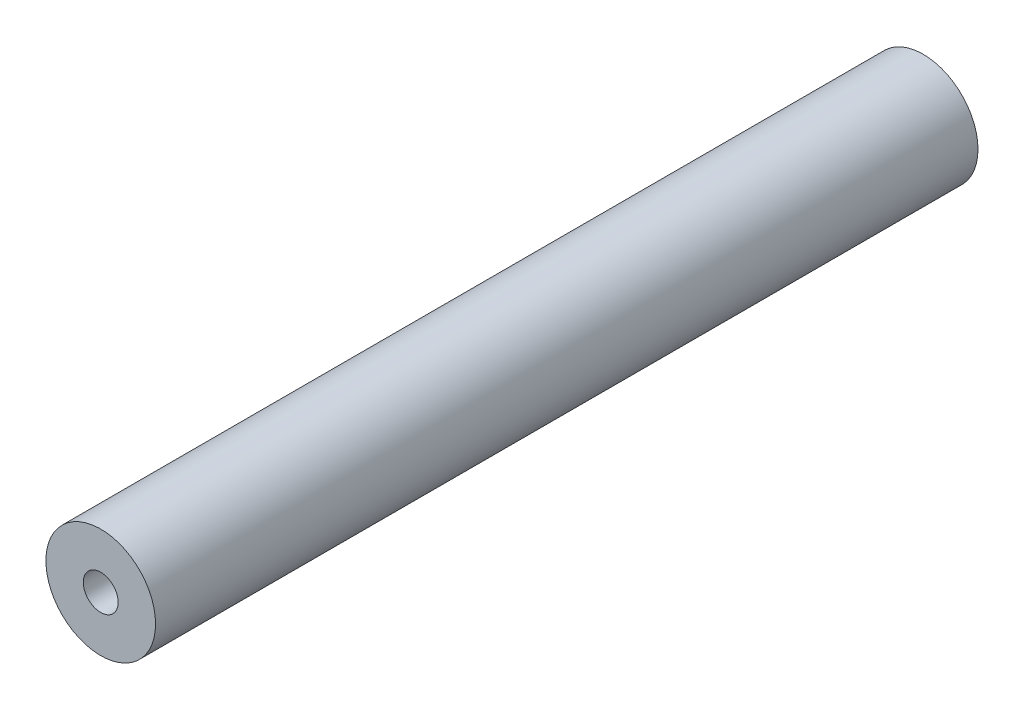
from build123d import *

# Parameters (mm, degrees)
SKETCH1_R                            = 6.35
BOSS_EXTRUDE1_DEPTH                  = 47.625
F_10_32_TAPPED_HOLE1_D               = 4.0386
F_10_32_TAPPED_HOLE1_DEPTH           = 12.02944
F_10_32_TAPPED_HOLE1_TIP             = 1.213317848
F_10_32_TAPPED_HOLE1_ON_FACE_2_D     = 4.0386
F_10_32_TAPPED_HOLE1_ON_FACE_2_DEPTH = 12.02944
F_10_32_TAPPED_HOLE1_ON_FACE_2_TIP   = 1.213317848


with BuildPart() as part:
    # Sketch1 → Boss-Extrude1 (new, symmetric)
    with BuildSketch(Plane.XY):
        Circle(SKETCH1_R)
    extrude(amount=BOSS_EXTRUDE1_DEPTH, both=True)

    # #10-32 Tapped Hole1
    with Locations(Plane(origin=(0, 0, -47.625), x_dir=(-1, 0, 0), z_dir=(0, 0, -1))):
        with Locations((0, 0)):
            Hole(F_10_32_TAPPED_HOLE1_D / 2, depth=F_10_32_TAPPED_HOLE1_DEPTH)
            with Locations((0, 0, -(F_10_32_TAPPED_HOLE1_DEPTH + F_10_32_TAPPED_HOLE1_TIP / 2))):  # 118° drill point
                Cone(0, F_10_32_TAPPED_HOLE1_D / 2, F_10_32_TAPPED_HOLE1_TIP, mode=Mode.SUBTRACT)

    # #10-32 Tapped Hole1 on face 2
    with Locations(Plane.XY.offset(47.625)):
        with Locations((0, 0)):
            Hole(F_10_32_TAPPED_HOLE1_ON_FACE_2_D / 2, depth=F_10_32_TAPPED_HOLE1_ON_FACE_2_DEPTH)
            with Locations((0, 0, -(F_10_32_TAPPED_HOLE1_ON_FACE_2_DEPTH + F_10_32_TAPPED_HOLE1_ON_FACE_2_TIP / 2))):  # 118° drill point
                Cone(0, F_10_32_TAPPED_HOLE1_ON_FACE_2_D / 2, F_10_32_TAPPED_HOLE1_ON_FACE_2_TIP, mode=Mode.SUBTRACT)


solid = part.part
